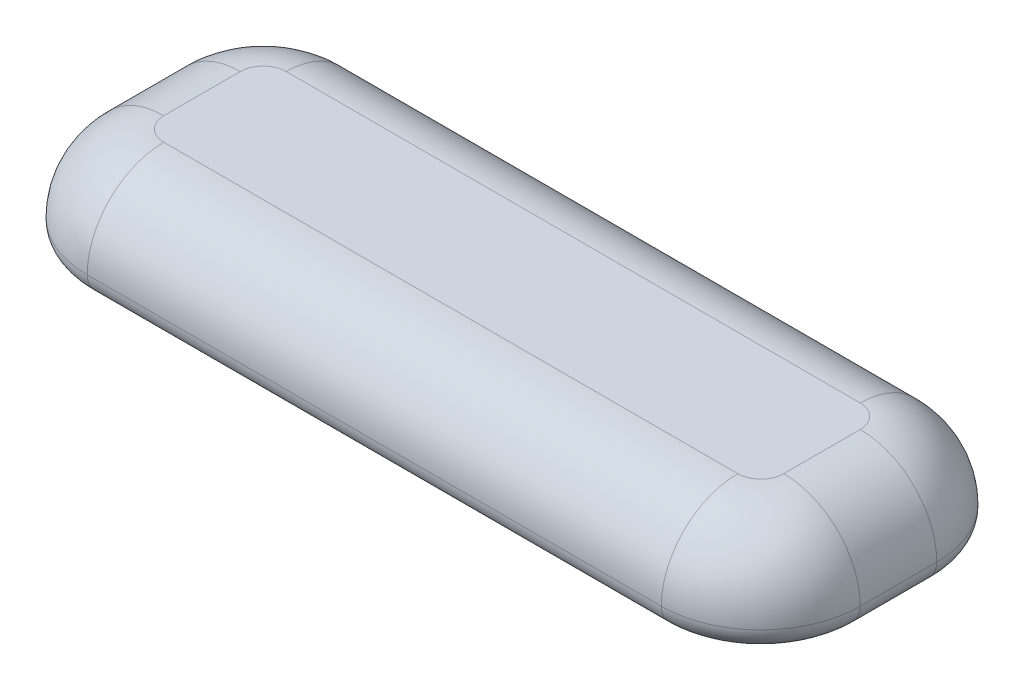
from build123d import *

# Parameters (mm, degrees)
EXTRUDE_1_DEPTH = 10
SHELL_2_T       = 3
FILLET_3_R      = 10
FILLET_4_R      = 3
SKETCH_2_R      = 2.675
EXTRUDE_2_DEPTH = 8
FILLET_7_R      = 5
CHAMFER_1_SIZE  = 0.2
CHAMFER_2_SIZE  = 0.2
FILLET_9_SIZE   = 5.5
FILLET_9_SIZE_2 = 5


# Some blends are built 0.0001 mm under size
with BuildPart() as part:
    # 草图1 → 凸台-拉伸1 (new body)
    with BuildSketch(Plane(origin=(0, 0, 0), x_dir=(1, 0, 0), z_dir=(0, 1, 0))):
        with BuildLine():
            Line((-37.5, 15), (37.5, 15))
            ThreePointArc((37.5, 15), (44.571067812, 12.071067812), (47.5, 5))
            Line((47.5, 5), (47.5, -5))
            ThreePointArc((47.5, -5), (44.571067812, -12.071067812), (37.5, -15))
            Line((37.5, -15), (-37.5, -15))
            ThreePointArc((-37.5, -15), (-44.571067812, -12.071067812), (-47.5, -5))
            Line((-47.5, -5), (-47.5, 5))
            ThreePointArc((-47.5, 5), (-44.571067812, 12.071067812), (-37.5, 15))
        make_face()
    extrude(amount=EXTRUDE_1_DEPTH)

    # 抽壳2
    shell_2_openings = [part.faces().sort_by_distance(p)[0] for p in [
        (0, 0, 0),
    ]]
    offset(amount=SHELL_2_T, openings=shell_2_openings, kind=Kind.INTERSECTION)

    # 圆角3
    # the kernel refuses this fillet: 10 mm, written as the material it takes off along each edge
    with BuildSketch(Plane(origin=(37.5, 13, 5), x_dir=(1, 0, 0), z_dir=(0, 0, -1))) as fillet_3_piece_1:
        with BuildLine():
            CenterArc((13 - FILLET_3_R, FILLET_3_R), FILLET_3_R, 270, 90)
            Line((13 - FILLET_3_R, 0), (13, 0))
            Line((13, 0), (13, FILLET_3_R))
        make_face()
    revolve(axis=Axis((37.5, 13, 5), (0, -1, 0)), revolution_arc=90, mode=Mode.SUBTRACT)
    with BuildSketch(Plane(origin=(50.5, 13, 5), x_dir=(0, -1, 0), z_dir=(0, 0, -1)), Plane(origin=(-50.5, 13, -5), x_dir=(0, -1, 0), z_dir=(0, 0, 1))) as fillet_3_piece_2:
        with BuildLine():
            CenterArc((FILLET_3_R, FILLET_3_R), FILLET_3_R, 180, 90)
            Line((0, FILLET_3_R), (0, 0))
            Line((0, 0), (FILLET_3_R, 0))
        make_face()
    extrude(amount=10, mode=Mode.SUBTRACT)
    with BuildSketch(Plane(origin=(37.5, 13, -5), x_dir=(0, 0, -1), z_dir=(-1, 0, 0))) as fillet_3_piece_3:
        with BuildLine():
            CenterArc((13 - FILLET_3_R, FILLET_3_R), FILLET_3_R, 270, 90)
            Line((13 - FILLET_3_R, 0), (13, 0))
            Line((13, 0), (13, FILLET_3_R))
        make_face()
    revolve(axis=Axis((37.5, 13, -5), (0, -1, 0)), revolution_arc=90, mode=Mode.SUBTRACT)
    with BuildSketch(Plane(origin=(37.5, 13, -18), x_dir=(0, -1, 0), z_dir=(-1, 0, 0)), Plane(origin=(-37.5, 13, 18), x_dir=(0, -1, 0), z_dir=(1, 0, 0))) as fillet_3_piece_4:
        with BuildLine():
            CenterArc((FILLET_3_R, FILLET_3_R), FILLET_3_R, 180, 90)
            Line((0, FILLET_3_R), (0, 0))
            Line((0, 0), (FILLET_3_R, 0))
        make_face()
    extrude(amount=75, mode=Mode.SUBTRACT)
    with BuildSketch(Plane(origin=(-37.5, 13, -5), x_dir=(-1, 0, 0), z_dir=(0, 0, 1))) as fillet_3_piece_5:
        with BuildLine():
            CenterArc((13 - FILLET_3_R, FILLET_3_R), FILLET_3_R, 270, 90)
            Line((13 - FILLET_3_R, 0), (13, 0))
            Line((13, 0), (13, FILLET_3_R))
        make_face()
    revolve(axis=Axis((-37.5, 13, -5), (0, -1, 0)), revolution_arc=90, mode=Mode.SUBTRACT)
    with BuildSketch(Plane(origin=(-37.5, 13, 5), x_dir=(0, 0, 1), z_dir=(1, 0, 0))) as fillet_3_piece_6:
        with BuildLine():
            CenterArc((13 - FILLET_3_R, FILLET_3_R), FILLET_3_R, 270, 90)
            Line((13 - FILLET_3_R, 0), (13, 0))
            Line((13, 0), (13, FILLET_3_R))
        make_face()
    revolve(axis=Axis((-37.5, 13, 5), (0, -1, 0)), revolution_arc=90, mode=Mode.SUBTRACT)

    # 圆角4
    fillet_4_edges = [part.edges().sort_by_distance(p)[0] for p in [
        (50.5, 0, 0),
        (46.692388155, 0, 14.192388155),
        (0, 0, 18),
        (-46.692388155, 0, 14.192388155),
        (-50.5, 0, 0),
        (-46.692388155, 0, -14.192388155),
        (0, 0, -18),
        (46.692388155, 0, -14.192388155),
    ]]
    fillet(fillet_4_edges, radius=FILLET_4_R - 0.0001)  # a hair under: the kernel refuses the full size

    # 草图2 → 凸台-拉伸2 (add)
    # profile 1 of 2: a face of its own
    with BuildSketch(Plane(origin=(0, 10, 0), x_dir=(-1, 0, 0), z_dir=(0, -1, 0))):
        with Locations(Location((36.8, 0, 0), (0, 0, 270))):
            Circle(SKETCH_2_R)
        Polygon((34.725, -0.575), (34.725, 0.575), (36.225, 0.575), (36.225, 2.075), (37.375, 2.075), (37.375, 0.575), (38.875, 0.575), (38.875, -0.575), (37.375, -0.575), (37.375, -2.075), (36.225, -2.075), (36.225, -0.575), align=None, mode=Mode.SUBTRACT)
    # profile 2 of 2: a face of its own
    with BuildSketch(Plane(origin=(0, 10, 0), x_dir=(-1, 0, 0), z_dir=(0, -1, 0))):
        with Locations(Location((-36.8, 0, 0), (0, 0, 90))):
            Circle(SKETCH_2_R)
        Polygon((-37.375, 0.575), (-37.375, 2.075), (-36.225, 2.075), (-36.225, 0.575), (-34.725, 0.575), (-34.725, -0.575), (-36.225, -0.575), (-36.225, -2.075), (-37.375, -2.075), (-37.375, -0.575), (-38.875, -0.575), (-38.875, 0.575), align=None, mode=Mode.SUBTRACT)
    extrude(amount=EXTRUDE_2_DEPTH)

    # 圆角7
    fillet_7_edges = [part.edges().sort_by_distance(p)[0] for p in [
        (-44.571067812, 10, 12.071067812),
        (0, 10, 15),
        (44.571067812, 10, 12.071067812),
        (47.5, 10, 0),
        (44.571067812, 10, -12.071067812),
        (0, 10, -15),
        (-44.571067812, 10, -12.071067812),
        (-47.5, 10, 0),
    ]]
    fillet(fillet_7_edges, radius=FILLET_7_R)

    # 倒角1
    chamfer_1_edges = [part.edges().sort_by_distance(p)[0] for p in [
        (35.475, 2, -0.575),
        (37.375, 2, 1.325),
        (38.875, 2, 0),
        (38.125, 2, -0.575),
        (37.375, 2, -1.325),
        (36.8, 2, -2.075),
        (34.725, 2, 0),
        (35.475, 2, 0.575),
        (36.225, 2, 1.325),
        (36.8, 2, 2.075),
        (38.125, 2, 0.575),
        (36.225, 2, -1.325),
    ]]
    chamfer(chamfer_1_edges, length=CHAMFER_1_SIZE)

    # 倒角2
    chamfer_2_edges = [part.edges().sort_by_distance(p)[0] for p in [
        (-36.8, 2, -2.075),
        (-37.375, 2, -1.325),
        (-38.125, 2, -0.575),
        (-38.875, 2, 0),
        (-37.375, 2, 1.325),
        (-35.475, 2, -0.575),
        (-38.125, 2, 0.575),
        (-36.8, 2, 2.075),
        (-36.225, 2, 1.325),
        (-35.475, 2, 0.575),
        (-34.725, 2, 0),
        (-36.225, 2, -1.325),
    ]]
    chamfer(chamfer_2_edges, length=CHAMFER_2_SIZE)

    # 圆角9
    # a fillet whose section is not a circle: 5.5, 5 mm, written as the material it adds along each edge
    with BuildSketch(Plane(origin=(36.8, 10, 0), x_dir=(0, 0, -1), z_dir=(-1, 0, 0))) as fillet_9_piece_1:
        with BuildLine():
            Bezier((2.675 + FILLET_9_SIZE, 0), (2.675, 0), (2.675, FILLET_9_SIZE_2), weights=[1, 0.333333333, 1])
            Line((2.675, FILLET_9_SIZE_2), (2.675, 0))
            Line((2.675, 0), (2.675 + FILLET_9_SIZE, 0))
        make_face()
    revolve(axis=Axis((36.8, 10, 0), (0, -1, 0)))

    # 圆角10
    # a fillet whose section is not a circle: 5.5, 5 mm, written as the material it adds along each edge (its section moved 0.00015 mm through the faces so that the kernel can cut it)
    with BuildSketch(Plane(origin=(-36.8, 10, 0), x_dir=(0, 0, 1), z_dir=(1, 0, 0))) as fillet_10_piece_1:
        with BuildLine():
            Bezier((7.675, -0.00015), (2.67485, -0.00015), (2.67485, 5.5), weights=[1, 0.333333333, 1])
            Line((2.67485, 5.5), (2.56485, 5.5))
            ThreePointArc((2.56485, 5.5), (2.565, 2.75), (2.565, 0))
            Line((2.565, 0), (2.675, -0.11))
            ThreePointArc((2.675, -0.11), (5.175, -0.11), (7.675, -0.11015))
            Line((7.675, -0.11015), (7.675, -0.00015))
        make_face()
    revolve(axis=Axis((-36.8, 10, 0), (0, -1, 0)))


solid = part.part
